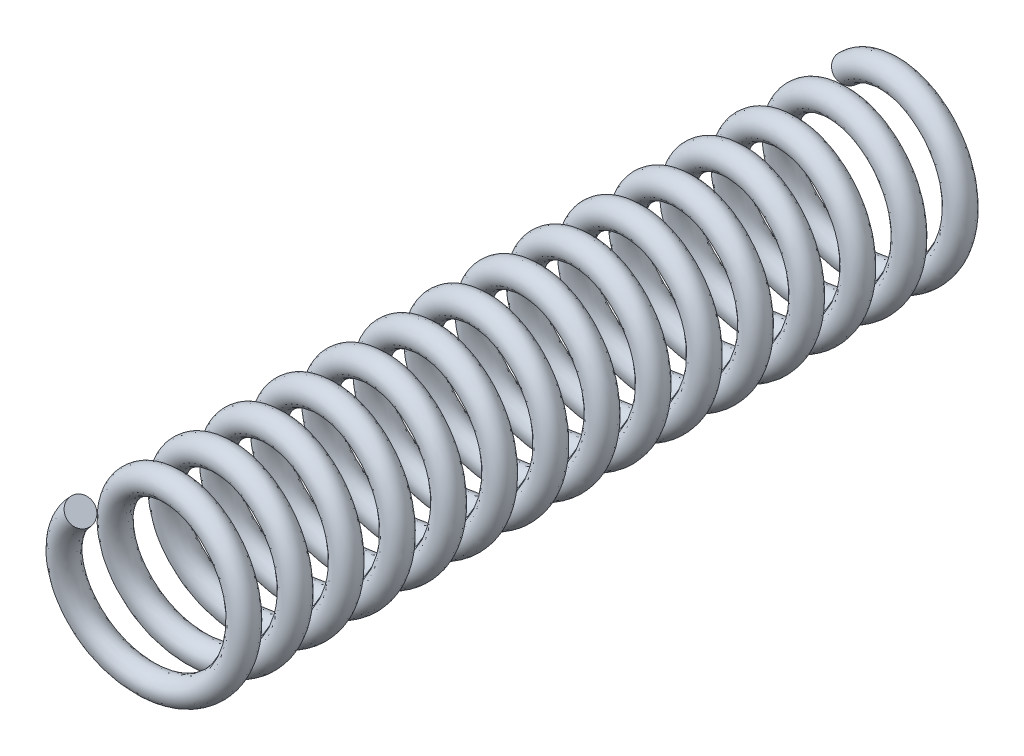
from build123d import *

# Parameters (mm, degrees)
SWEEP_1_PITCH       = 1
SWEEP_1_HEIGHT      = 15
SWEEP_1_RADIUS      = 1.5
SWEEP_1_START_ANGLE = 135
SWEEP_1_PROFILE_R   = 0.25


with BuildPart() as part:
    # 扫描1: sweep along a helix
    with BuildLine() as sweep_1_path:
        add(Helix(SWEEP_1_PITCH, SWEEP_1_HEIGHT, SWEEP_1_RADIUS, center=(0, 0, 0), direction=(0, 0, 1), lefthand=True, mode=Mode.PRIVATE).rotate(Axis((0, 0, 0), (0, 0, 1)), SWEEP_1_START_ANGLE))
    # 扫描1 profile (on start of the path) → 扫描1 (sweep)
    with BuildSketch(Plane(origin=(-1.060660172, 1.060660172, 0), x_dir=(-0.7071067811864492, 0.707106781186646, 0), z_dir=(0.7031598041268381, 0.7031598041266424, 0.1055110407535094))):
        Circle(SWEEP_1_PROFILE_R)
    sweep(path=sweep_1_path.line, is_frenet=True)


solid = part.part
